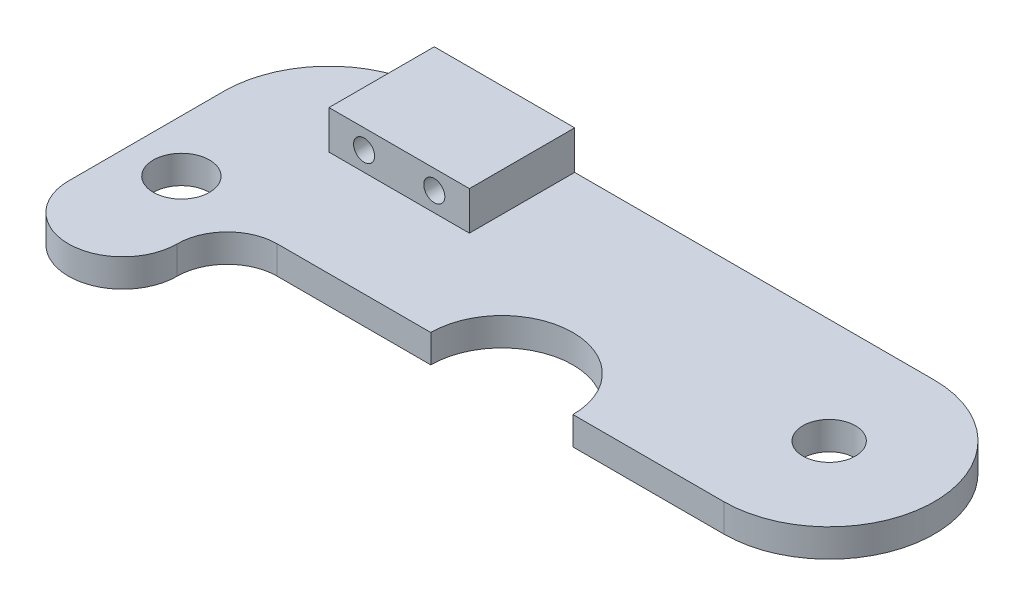
from build123d import *

# Parameters (mm, degrees)
SKETCH1_R           = 1.6
SKETCH1_R_2         = 1.5
BOSS_EXTRUDE1_DEPTH = 1.6
SKETCH2_W           = 8
SKETCH2_H           = 6
BOSS_EXTRUDE2_DEPTH = 2.2
CUT_EXTRUDE1_REACH  = 77.825
SKETCH3_R           = 0.6


with BuildPart() as part:
    # Sketch1 → Boss-Extrude1 (new body)
    with BuildSketch(Plane(origin=(0, 0, 0), x_dir=(1, 0, 0), z_dir=(0, 1, 0))):
        with BuildLine():
            Line((67.571877104, -176.802493772), (39.071877104, -176.802493772))
            ThreePointArc((39.071877104, -176.802493772), (34.846951069, -178.542212091), (33.072085441, -182.752493772))
            Line((33.072085441, -182.752493772), (33.072085441, -191.652493772))
            ThreePointArc((33.072085441, -191.652493772), (36.172085441, -194.752493772), (39.272085441, -191.652493772))
            ThreePointArc((39.272085441, -191.652493772), (40.106831114, -189.637239445), (42.122085441, -188.802493772))
            Line((42.122085441, -188.802493772), (50.872085441, -188.802493772))
            ThreePointArc((50.872085441, -188.802493772), (54.922085441, -184.752493772), (58.972085441, -188.802493772))
            Line((58.972085441, -188.802493772), (67.571877104, -188.802493772))
            ThreePointArc((67.571877104, -188.802493772), (73.571877104, -182.802493772), (67.571877104, -176.802493772))
        make_face()
        with Locations((36.052926365, -188.193770201)):
            Circle(SKETCH1_R, mode=Mode.SUBTRACT)
        with Locations((67.571877104, -182.802493772)):
            Circle(SKETCH1_R_2, mode=Mode.SUBTRACT)
    extrude(amount=BOSS_EXTRUDE1_DEPTH)

    # Sketch2 → Boss-Extrude2 (add)
    with BuildSketch(Plane(origin=(0, 1.6, 0), x_dir=(1, 0, 0), z_dir=(0, 1, 0))):
        with Locations((43.071877104, -179.802493772)):
            Rectangle(SKETCH2_W, SKETCH2_H)
    extrude(amount=BOSS_EXTRUDE2_DEPTH)

    # Sketch3 → Cut-Extrude1 (cut, up to next)
    with BuildSketch(Plane(origin=(0, 0, 176.802493772), x_dir=(-1, 0, 0), z_dir=(0, 0, -1)), mode=Mode.PRIVATE) as cut_extrude1_sk1:
        with Locations((-45.071877104, 2.7)):
            Circle(SKETCH3_R)
    cut_extrude1_tool1 = extrude(cut_extrude1_sk1.sketch, amount=-CUT_EXTRUDE1_REACH, mode=Mode.PRIVATE) & part.part
    # Sketch3 → Cut-Extrude1 (cut, up to next)
    with BuildSketch(Plane(origin=(0, 0, 176.802493772), x_dir=(-1, 0, 0), z_dir=(0, 0, -1)), mode=Mode.PRIVATE) as cut_extrude1_sk2:
        with Locations((-41.071877104, 2.7)):
            Circle(SKETCH3_R)
    cut_extrude1_tool2 = extrude(cut_extrude1_sk2.sketch, amount=-CUT_EXTRUDE1_REACH, mode=Mode.PRIVATE) & part.part
    add(cut_extrude1_tool1.solids().sort_by_distance((45.071877, 2.7, 176.802494))[0], mode=Mode.SUBTRACT)
    add(cut_extrude1_tool2.solids().sort_by_distance((41.071877, 2.7, 176.802494))[0], mode=Mode.SUBTRACT)


solid = part.part
